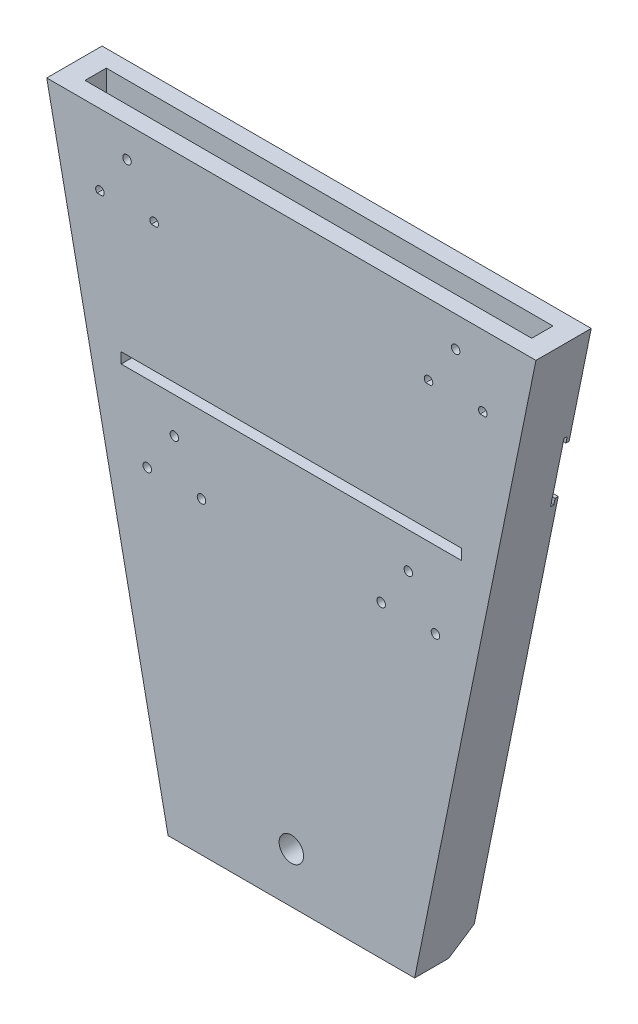
from build123d import *

# Parameters (mm, degrees)
EXTRUDE_1_DEPTH      = 8
CUT_EXTRUDE_1_DEPTH  = 8.6
EXTRUDE_2_DEPTH      = 8
EXTRUDE_3_DEPTH      = 10
SKETCH_7_R           = 5.75
CUT_EXTRUDE_2_DEPTH  = 22
EXTRUDE_5_DEPTH      = 26
CUT_EXTRUDE_4_DEPTH  = 21
CHAMFER_6_SIZE       = 5
CHAMFER_8_SIZE       = 10
SKETCH_13_W          = 210
SKETCH_13_H          = 10
CUT_EXTRUDE_5_DEPTH  = 15
SKETCH_14_W          = 160
SKETCH_14_H          = 5
CUT_EXTRUDE_6_DEPTH  = 10
SKETCH_16_R          = 2
CUT_EXTRUDE_7_DEPTH  = 10
SKETCH_18_W          = 109.386418102
SKETCH_18_H          = 16
EXTRUDE_7_DEPTH      = 2
CHAMFER_10_SIZE      = 2
SKETCH_32_W          = 100
SKETCH_32_H          = 25
CUT_EXTRUDE_16_DEPTH = 3
SKETCH_33_W          = 3
SKETCH_33_H          = 25
CUT_EXTRUDE_17_DEPTH = 1003
SKETCH_34_W          = 1.5
SKETCH_34_H          = 25
CUT_EXTRUDE_19_DEPTH = 3
SKETCH_36_W          = 111.215468024
SKETCH_36_H          = 1.5
CUT_EXTRUDE_20_DEPTH = 3
CUT_EXTRUDE_21_DEPTH = 3
SKETCH_38_W          = 1.5
SKETCH_38_H          = 31
CUT_EXTRUDE_22_DEPTH = 1003


with BuildPart() as part:
    # 草图1 → 凸台-拉伸1 (new body)
    with BuildSketch(Plane.XY):
        Polygon((-60, 0), (60, 0), (115, 270), (-115, 270), align=None)
    extrude(amount=EXTRUDE_1_DEPTH)

    # 草图2 → 切除-拉伸1 (cut)
    with BuildSketch(Plane.XY.offset(8)):
        with BuildLine():
            Line((0.005000474, 0.310000947), (0, 0.3))
            Line((0, 0.3), (17.48870838, 0.3))
            Line((17.48870838, 0.3), (12.108893566, 26.71))
            Line((12.108893566, 26.71), (0, 26.71))
            ThreePointArc((0, 26.71), (-13.199999763, 13.507499763), (0.005000474, 0.310000947))
        make_face()
    extrude(amount=-CUT_EXTRUDE_1_DEPTH, mode=Mode.SUBTRACT)

    # 草图5 → 凸台-拉伸2 (add)
    with BuildSketch(Plane(origin=(0, 0, 0), x_dir=(-1, 0, 0), z_dir=(0, 0, -1))):
        Polygon((60, 0), (115, 270), (-115, 270), (-60, 0), align=None)
    extrude(amount=EXTRUDE_2_DEPTH)

    # 草图6 → 凸台-拉伸3 (add)
    with BuildSketch(Plane.XY.offset(8)):
        Polygon((-115, 270), (-60, 0), (60, 0), (115, 270), align=None)
    extrude(amount=EXTRUDE_3_DEPTH)

    # 草图7 → 切除-拉伸2 (cut)
    with BuildSketch(Plane.XY.offset(18)):
        with Locations((0, 13.51)):
            Circle(SKETCH_7_R)
    extrude(amount=-CUT_EXTRUDE_2_DEPTH, mode=Mode.SUBTRACT)

    # 草图9 → 凸台-拉伸5 (add)
    with BuildSketch(Plane.XY.offset(18)):
        Polygon((-57.962962963, -10), (-60, 0), (60, 0), (57.962962963, -10), align=None)
    extrude(amount=-EXTRUDE_5_DEPTH)

    # 草图12 → 切除-拉伸4 (cut)
    with BuildSketch(Plane.XY.offset(-8)):
        Polygon((54.693209051, 0), (-54.693209051, 0), (-52.656172014, -10), (52.656172014, -10), align=None)
    extrude(amount=CUT_EXTRUDE_4_DEPTH, mode=Mode.SUBTRACT)

    # 倒角6
    chamfer_6_edges = [part.edges().sort_by_distance(p)[0] for p in [
        (0, 0, -8),
    ]]
    chamfer(chamfer_6_edges, length=CHAMFER_6_SIZE)

    # 倒角8
    chamfer_8_edges = [part.edges().sort_by_distance(p)[0] for p in [
        (55.309567488, -10, -8),
        (-55.309567488, -10, -8),
    ]]
    chamfer(chamfer_8_edges, length=CHAMFER_8_SIZE)

    # 草图13 → 切除-拉伸5 (cut)
    with BuildSketch(Plane(origin=(0, 270, 0), x_dir=(1, 0, 0), z_dir=(0, 1, 0))):
        with Locations((0, -5)):
            Rectangle(SKETCH_13_W, SKETCH_13_H)
    extrude(amount=-CUT_EXTRUDE_5_DEPTH, mode=Mode.SUBTRACT)

    # 草图14 → 切除-拉伸6 (cut)
    with BuildSketch(Plane.XY.offset(18)):
        with Locations((0, 173.51)):
            Rectangle(SKETCH_14_W, SKETCH_14_H)
    extrude(amount=-CUT_EXTRUDE_6_DEPTH, mode=Mode.SUBTRACT)

    # 草图16 → 切除-拉伸7 (cut)
    with BuildSketch(Plane.XY.offset(18)):
        with BuildLine():
            ThreePointArc((-88.677124344, 235), (-90, 238.5), (-91.322875656, 235))
            Line((-91.322875656, 235), (-88.677124344, 235))
        make_face()
        with BuildLine():
            ThreePointArc((91.322875656, 235), (90, 238.5), (88.677124344, 235))
            Line((88.677124344, 235), (91.322875656, 235))
        make_face()
        with BuildLine():
            ThreePointArc((65.822875656, 235), (64.5, 238.5), (63.177124344, 235))
            Line((63.177124344, 235), (65.822875656, 235))
        make_face()
        with BuildLine():
            ThreePointArc((-63.177124344, 235), (-64.5, 238.5), (-65.822875656, 235))
            Line((-65.822875656, 235), (-63.177124344, 235))
        make_face()
        with Locations((-77.25, 255.6425573)):
            Circle(SKETCH_16_R)
        with Locations((77.25, 255.6425573)):
            Circle(SKETCH_16_R)
        with Locations((-55, 154.1525573)):
            Circle(SKETCH_16_R)
        with Locations((-67.75, 135.01)):
            Circle(SKETCH_16_R)
        with Locations((-42.25, 135.01)):
            Circle(SKETCH_16_R)
        with Locations((42.25, 135.01)):
            Circle(SKETCH_16_R)
        with Locations((67.75, 135.01)):
            Circle(SKETCH_16_R)
        with Locations((55, 154.1525573)):
            Circle(SKETCH_16_R)
    extrude(amount=-CUT_EXTRUDE_7_DEPTH, mode=Mode.SUBTRACT)

    # 草图18 → 凸台-拉伸7 (add)
    with BuildSketch(Plane.XZ):
        with Locations((0, 5)):
            Rectangle(SKETCH_18_W, SKETCH_18_H)
    extrude(amount=EXTRUDE_7_DEPTH)

    # 倒角10
    chamfer_10_edges = [part.edges().sort_by_distance(p)[0] for p in [
        (0, -2, -3),
    ]]
    chamfer(chamfer_10_edges, length=CHAMFER_10_SIZE - 0.0001)  # a hair under: the kernel refuses the full size

    # 草图32 → 切除-拉伸16 (cut)
    with BuildSketch(Plane(origin=(0, 0, -8), x_dir=(-1, 0, 0), z_dir=(0, 0, -1))):
        with Locations((-46.363148148, 206.34047939)):
            Rectangle(SKETCH_32_W, SKETCH_32_H)
    extrude(amount=-CUT_EXTRUDE_16_DEPTH, mode=Mode.SUBTRACT)

    # 草图33 → 切除-拉伸17 (cut)
    with BuildSketch(Plane(origin=(-3.636851852, 0, 0), x_dir=(0, 0, -1), z_dir=(1, 0, 0))):
        with Locations((6.5, 206.34047939)):
            Rectangle(SKETCH_33_W, SKETCH_33_H)
    extrude(amount=CUT_EXTRUDE_17_DEPTH, mode=Mode.SUBTRACT)

    # 草图34 → 切除-拉伸19 (cut)
    with BuildSketch(Plane(origin=(-3.636851852, 0, 0), x_dir=(0, 0, -1), z_dir=(1, 0, 0))):
        with Locations((5.75, 206.34047939)):
            Rectangle(SKETCH_34_W, SKETCH_34_H)
    extrude(amount=-CUT_EXTRUDE_19_DEPTH, mode=Mode.SUBTRACT)

    # 草图36 → 切除-拉伸20 (cut)
    with BuildSketch(Plane.XZ.offset(-218.84047939)):
        with Locations((48.97088216, -5.75)):
            Rectangle(SKETCH_36_W, SKETCH_36_H)
    extrude(amount=-CUT_EXTRUDE_20_DEPTH, mode=Mode.SUBTRACT)

    # 草图37 → 切除-拉伸21 (cut)
    with BuildSketch(Plane(origin=(0, 193.84047939, 0), x_dir=(1, 0, 0), z_dir=(0, 1, 0))):
        Polygon((-6.636851852, 6.5), (-6.636851852, 5), (99.486023579, 5), (99.486023579, 6.5), (-3.636851852, 6.5), align=None)
    extrude(amount=-CUT_EXTRUDE_21_DEPTH, mode=Mode.SUBTRACT)

    # 草图38 → 切除-拉伸22 (cut)
    with BuildSketch(Plane(origin=(-6.636851852, 0, 0), x_dir=(0, 0, -1), z_dir=(1, 0, 0))):
        with Locations((5.75, 206.34047939)):
            Rectangle(SKETCH_38_W, SKETCH_38_H)
    extrude(amount=CUT_EXTRUDE_22_DEPTH, mode=Mode.SUBTRACT)


solid = part.part
